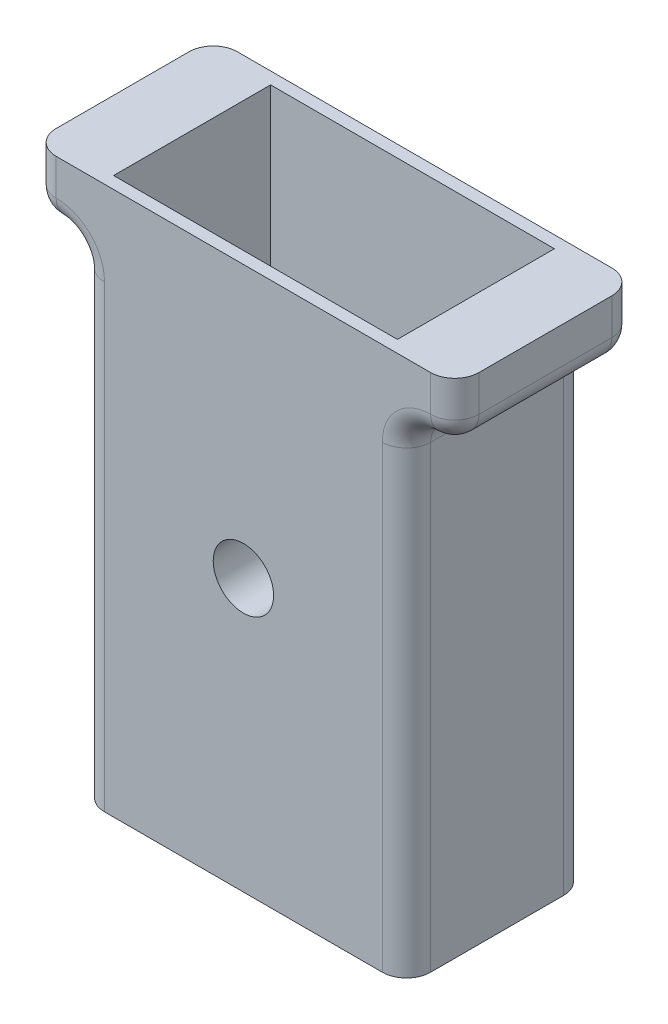
from build123d import *

# Parameters (mm, degrees)
SKETCH1_W           = 27
SKETCH1_H           = 15
BOSS_EXTRUDE1_DEPTH = 45
SKETCH2_W           = 35
SKETCH2_H           = 15
BOSS_EXTRUDE2_DEPTH = 5
SKETCH3_W           = 23.5
SKETCH3_H           = 13
CUT_EXTRUDE1_DEPTH  = 17
SKETCH4_W           = 8.5
SKETCH4_H           = 3.5
CUT_EXTRUDE2_DEPTH  = 17
SKETCH5_R           = 2.5
CUT_EXTRUDE3_DEPTH  = 17
FILLET1_R           = 2
SKETCH6_R           = 5.75
CUT_EXTRUDE4_DEPTH  = 5


with BuildPart() as part:
    # Sketch1 → Boss-Extrude1 (new body)
    with BuildSketch(Plane(origin=(0, 0, 0), x_dir=(1, 0, 0), z_dir=(0, 1, 0))):
        with Locations((13.5, 7.5)):
            Rectangle(SKETCH1_W, SKETCH1_H)
    extrude(amount=BOSS_EXTRUDE1_DEPTH)

    # Sketch2 → Boss-Extrude2 (add)
    with BuildSketch(Plane(origin=(0, 45, 0), x_dir=(1, 0, 0), z_dir=(0, 1, 0))):
        with Locations((13.5, 7.5)):
            Rectangle(SKETCH2_W, SKETCH2_H)
    extrude(amount=-BOSS_EXTRUDE2_DEPTH)

    # Sketch3 → Cut-Extrude1 (cut)
    with BuildSketch(Plane(origin=(0, 45, 0), x_dir=(1, 0, 0), z_dir=(0, 1, 0))):
        with Locations((13.5, 7.5)):
            Rectangle(SKETCH3_W, SKETCH3_H)
    extrude(amount=-CUT_EXTRUDE1_DEPTH, mode=Mode.SUBTRACT)

    # Sketch4 → Cut-Extrude2 (cut)
    with BuildSketch(Plane.ZY):
        with Locations((-7.5, 29.75)):
            Rectangle(SKETCH4_W, SKETCH4_H)
    extrude(amount=-CUT_EXTRUDE2_DEPTH, mode=Mode.SUBTRACT)

    # Sketch5 → Cut-Extrude3 (cut)
    with BuildSketch(Plane(origin=(0, 0, -15), x_dir=(-1, 0, 0), z_dir=(0, 0, -1))):
        with Locations((-13.5, 22.5)):
            Circle(SKETCH5_R)
    extrude(amount=-CUT_EXTRUDE3_DEPTH, mode=Mode.SUBTRACT)

    # Fillet1
    fillet1_edges = [part.edges().sort_by_distance(p)[0] for p in [
        (0, 40, -7.5),
        (27, 40, -7.5),
    ]]
    fillet(fillet1_edges, radius=FILLET1_R)
    fillet1_2_edges = [part.edges().sort_by_distance(p)[0] for p in [
        (-4, 42.5, -15),
        (-4, 42.5, 0),
        (-4, 40, -7.5),
        (31, 40, -7.5),
        (31, 42.5, 0),
        (31, 42.5, -15),
        (0, 19, -15),
        (0, 19, 0),
        (27, 19, 0),
        (27, 19, -15),
        (27.585786438, 39.414213562, -15),
        (27.585786438, 39.414213562, 0),
        (-0.585786438, 39.414213562, 0),
        (-0.585786438, 39.414213562, -15),
    ]]
    fillet(fillet1_2_edges, radius=FILLET1_R - 0.0001)  # a hair under: the kernel refuses the full size

    # Sketch6 → Cut-Extrude4 (cut)
    with BuildSketch(Plane(origin=(0, 0, -15), x_dir=(-1, 0, 0), z_dir=(0, 0, -1))):
        with Locations((-13.5, 22.5)):
            Circle(SKETCH6_R)
    extrude(amount=-CUT_EXTRUDE4_DEPTH, mode=Mode.SUBTRACT)


solid = part.part
